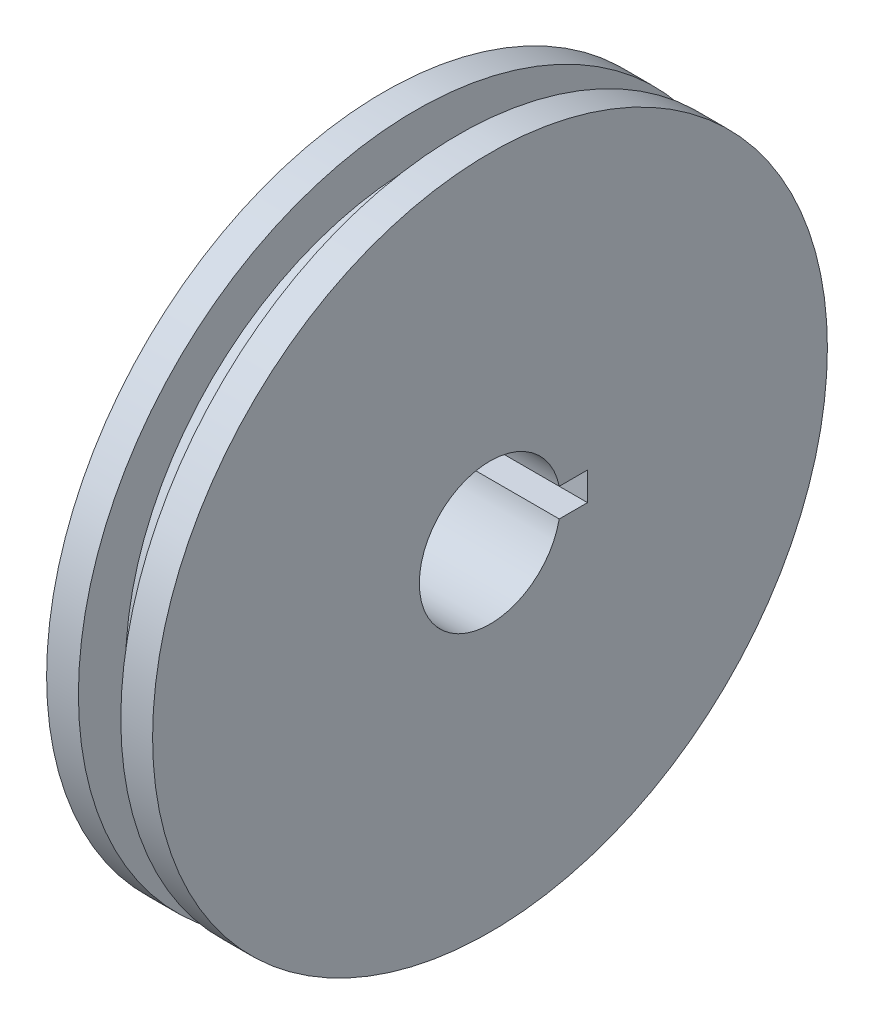
from build123d import *

# Parameters (mm, degrees)
CUT_EXTRUDE_START   = -15
CUT_EXTRUDE_1_DEPTH = 15


with BuildPart() as part:
    # 草图1 → 旋转1 (revolve)
    with BuildSketch(Plane(origin=(0, 0, 0), x_dir=(1, 0, 0), z_dir=(0, 1, 0))):
        Polygon((-7.5, 10), (-7.5, 47.75), (-3, 47.75), (-3, 41.078952229), (3, 41.078952229), (3, 47.75), (7.5, 47.75), (7.5, 10), align=None)
    revolve(axis=Axis((-58.327347129, 0, 0), (1, 0, 0)))

    # 草图2 → 切除-拉伸1 (cut)
    with BuildSketch(Plane(origin=(7.5, 0, 0), x_dir=(0, 0, -1), z_dir=(1, 0, 0)).offset(CUT_EXTRUDE_START)):
        with BuildLine():
            Line((9.797958971, 2), (13.797958971, 2))
            Line((13.797958971, 2), (13.797958971, -2))
            Line((13.797958971, -2), (9.797958971, -2))
            ThreePointArc((9.797958971, -2), (10, 0), (9.797958971, 2))
        make_face()
    extrude(amount=CUT_EXTRUDE_1_DEPTH, mode=Mode.SUBTRACT)


solid = part.part
